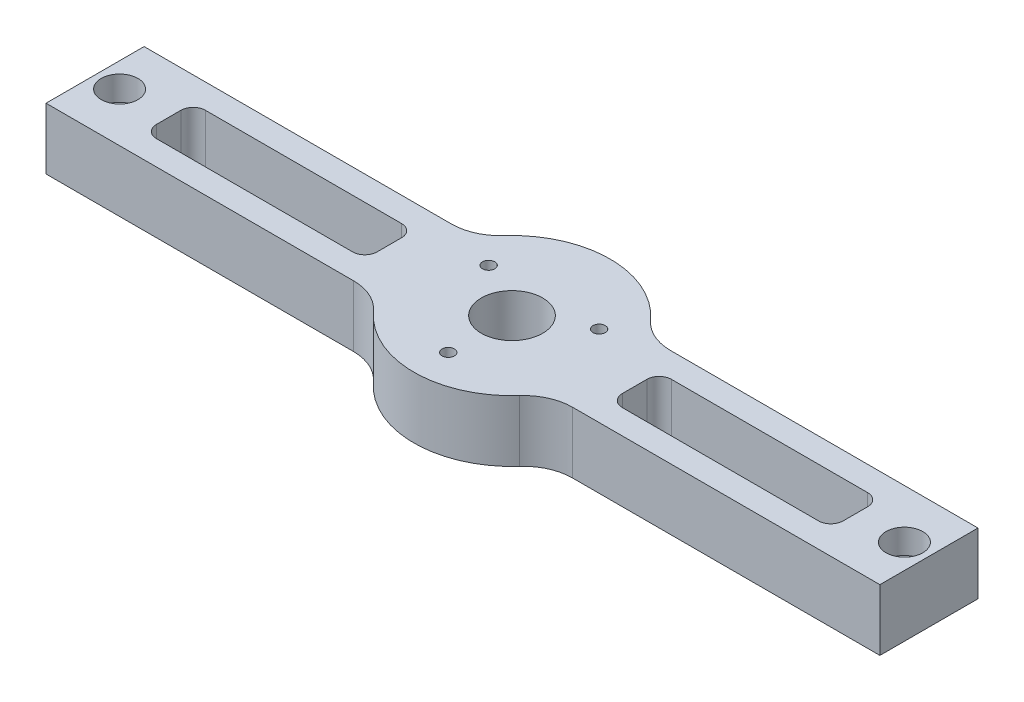
from build123d import *

# Parameters (mm, degrees)
SKETCH2_R           = 7.9375
BOSS_EXTRUDE1_DEPTH = 15.875
FILLET1_R           = 12.7
SKETCH3_R           = 22.225
CUT_EXTRUDE1_DEPTH  = 3.175
SKETCH4_R           = 4.7625
CUT_EXTRUDE2_DEPTH  = 6.35
SKETCH5_R           = 3.175
CUT_EXTRUDE3_DEPTH  = 115.871833471
SKETCH6_R           = 1.5875
CUT_EXTRUDE4_DEPTH  = 116.178567885
SKETCH7_W           = 57.15
SKETCH7_H           = 12.7
CUT_EXTRUDE5_DEPTH  = 116.571744492
FILLET2_R           = 3.175


with BuildPart() as part:
    # Sketch2 → Boss-Extrude1 (new body)
    with BuildSketch(Plane(origin=(0, 0, 0), x_dir=(1, 0, 0), z_dir=(0, 1, 0))):
        with BuildLine():
            Line((-107.95, 0), (-107.95, -25.4))
            Line((-107.95, -25.4), (-21.997045256, -25.4))
            ThreePointArc((-21.997045256, -25.4), (0, -38.1), (21.997045256, -25.4))
            Line((21.997045256, -25.4), (107.95, -25.4))
            Line((107.95, -25.4), (107.95, 0))
            Line((107.95, 0), (21.997045256, 0))
            ThreePointArc((21.997045256, 0), (0, 12.7), (-21.997045256, 0))
            Line((-21.997045256, 0), (-107.95, 0))
        make_face()
        with Locations((0, -12.7)):
            Circle(SKETCH2_R, mode=Mode.SUBTRACT)
    extrude(amount=BOSS_EXTRUDE1_DEPTH)

    # Fillet1
    fillet1_edges = [part.edges().sort_by_distance(p)[0] for p in [
        (21.997045256, 7.9375, 0),
        (21.997045256, 7.9375, 25.4),
        (-21.997045256, 7.9375, 25.4),
        (-21.997045256, 7.9375, 0),
    ]]
    fillet(fillet1_edges, radius=FILLET1_R)

    # Sketch3 → Cut-Extrude1 (cut)
    with BuildSketch(Plane.XZ):
        with Locations((0, 12.7)):
            Circle(SKETCH3_R)
    extrude(amount=-CUT_EXTRUDE1_DEPTH, mode=Mode.SUBTRACT)

    # Sketch4 → Cut-Extrude2 (cut)
    with BuildSketch(Plane(origin=(0, 15.875, 0), x_dir=(1, 0, 0), z_dir=(0, 1, 0))):
        with Locations((-101.6, -12.7)):
            Circle(SKETCH4_R)
        with Locations((101.6, -12.7)):
            Circle(SKETCH4_R)
    extrude(amount=-CUT_EXTRUDE2_DEPTH, mode=Mode.SUBTRACT)

    # Sketch5 → Cut-Extrude3 (cut, through all)
    with BuildSketch(Plane(origin=(0, 9.525, 0), x_dir=(1, 0, 0), z_dir=(0, 1, 0))):
        with Locations((-101.6, -12.7)):
            Circle(SKETCH5_R)
        with Locations((101.6, -12.7)):
            Circle(SKETCH5_R)
    extrude(amount=-CUT_EXTRUDE3_DEPTH, mode=Mode.SUBTRACT)

    # Sketch6 → Cut-Extrude4 (cut, through all)
    with BuildSketch(Plane.XZ.offset(-3.175)):
        with Locations((0, 29.21)):
            Circle(SKETCH6_R)
        with Locations((14.298079416, 4.445)):
            Circle(SKETCH6_R)
        with Locations((-14.298079416, 4.445)):
            Circle(SKETCH6_R)
    extrude(amount=-CUT_EXTRUDE4_DEPTH, mode=Mode.SUBTRACT)

    # Sketch7 → Cut-Extrude5 (cut, through all)
    with BuildSketch(Plane(origin=(0, 15.875, 0), x_dir=(1, 0, 0), z_dir=(0, 1, 0))):
        with Locations((-60.325, -12.7)):
            Rectangle(SKETCH7_W, SKETCH7_H)
        with Locations((60.325, -12.7)):
            Rectangle(SKETCH7_W, SKETCH7_H)
    extrude(amount=-CUT_EXTRUDE5_DEPTH, mode=Mode.SUBTRACT)

    # Fillet2
    fillet2_edges = [part.edges().sort_by_distance(p)[0] for p in [
        (31.75, 7.9375, 6.35),
        (31.75, 7.9375, 19.05),
        (88.9, 7.9375, 19.05),
        (88.9, 7.9375, 6.35),
        (-31.75, 7.9375, 6.35),
        (-31.75, 7.9375, 19.05),
        (-88.9, 7.9375, 19.05),
        (-88.9, 7.9375, 6.35),
    ]]
    fillet(fillet2_edges, radius=FILLET2_R)


solid = part.part
